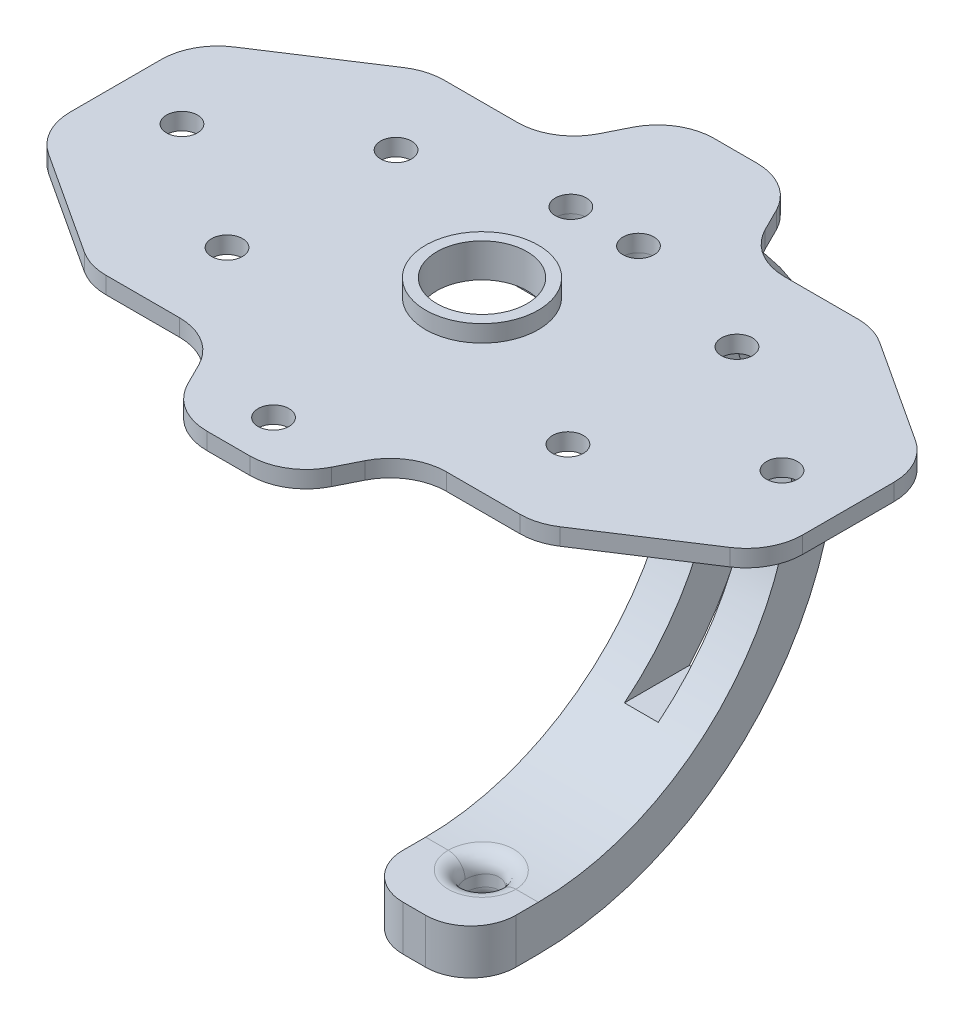
from build123d import *

# Parameters (mm, degrees)
SKETCH1_W                = 130
SKETCH1_H                = 130
BOSS_EXTRUDE1_DEPTH      = 3
SKETCH2_R                = 8
CUT_EXTRUDE1_DEPTH       = 3
M5_CLEARANCE_HOLE1_D     = 5.5
SKETCH5_OUTSIDE_W        = 168.774
SKETCH5_OUTSIDE_H        = 168.774
CUT_EXTRUDE2_DEPTH       = 92.972822073
BOSS_EXTRUDE2_DEPTH      = 3
FILLET1_R                = 10
M5_CLEARANCE_HOLE2_D     = 5.5
BOSS_EXTRUDE3_START      = 3
SKETCH9_R                = 10
SKETCH9_R_2              = 8
BOSS_EXTRUDE3_DEPTH      = 3
BOSS_EXTRUDE4_DEPTH      = 10
FILLET3_R                = 8
SKETCH12_W               = 6
SKETCH12_H               = 60
CUT_EXTRUDE4_DEPTH       = 126.231785103
CUT_EXTRUDE5_DEPTH       = 124.753787821
CUT_EXTRUDE5_DEPTH_BACK  = 124.753787821
SKETCH13_R               = 3
FILLET4_R                = 3
M5_CLEARANCE_HOLE3_D     = 5.5
M5_CLEARANCE_HOLE3_DEPTH = 10
M5_CLEARANCE_HOLE3_TIP   = 1.652366702


# Read off the part's stored shape, not the designer's step: Split1
with BuildPart() as part:
    # Sketch1 → Boss-Extrude1 (new body)
    with BuildSketch(Plane(origin=(0, 0, 0), x_dir=(1, 0, 0), z_dir=(0, 1, 0))):
        Rectangle(SKETCH1_W, SKETCH1_H)
    extrude(amount=BOSS_EXTRUDE1_DEPTH)

    # Sketch2 → Cut-Extrude1 (cut)
    with BuildSketch(Plane(origin=(0, 3, 0), x_dir=(1, 0, 0), z_dir=(0, 1, 0))):
        with Locations(Location((0, 0, 0), (0, 0, 270))):
            Circle(SKETCH2_R)
    extrude(amount=-CUT_EXTRUDE1_DEPTH, mode=Mode.SUBTRACT)

    # M5 Clearance Hole1 (through all)
    with Locations(Plane(origin=(0, 0, 0), x_dir=(-1, 0, 0), z_dir=(0, -1, 0))):
        with Locations((30.25, 15), (53.25, 0), (30.25, -15), (-30.25, -15), (-53.25, 0), (-30.25, 15)):
            Hole(M5_CLEARANCE_HOLE1_D / 2)

    # Sketch5 outside → Cut-Extrude2 (cut, through all)
    with BuildSketch(Plane.XZ):
        Rectangle(SKETCH5_OUTSIDE_W, SKETCH5_OUTSIDE_H)
        Polygon((-65, 13.5), (-39.7, 30), (39.7, 30), (65, 13.5), (65, -13.5), (39.7, -30), (-39.7, -30), (-65, -13.5), align=None, mode=Mode.SUBTRACT)
    extrude(amount=-CUT_EXTRUDE2_DEPTH, mode=Mode.SUBTRACT)

    # Sketch6 → Boss-Extrude2 (add)
    with BuildSketch(Plane(origin=(0, 3, 0), x_dir=(1, 0, 0), z_dir=(0, 1, 0))):
        Polygon((-17.5, 30), (-10, 45), (10, 45), (17.5, 30), align=None)
        Polygon((-17.5, -30), (17.5, -30), (10, -45), (-10, -45), align=None)
    extrude(amount=-BOSS_EXTRUDE2_DEPTH)

    # Fillet1
    fillet1_edges = [part.edges().sort_by_distance(p)[0] for p in [
        (-17.5, 1.5, -30),
        (-10, 1.5, -45),
        (10, 1.5, -45),
        (-10, 1.5, 45),
        (-17.5, 1.5, 30),
        (17.5, 1.5, 30),
        (10, 1.5, 45),
        (-65, 1.5, 13.5),
        (-39.7, 1.5, 30),
        (39.7, 1.5, 30),
        (65, 1.5, 13.5),
        (65, 1.5, -13.5),
        (39.7, 1.5, -30),
        (-39.7, 1.5, -30),
        (-65, 1.5, -13.5),
        (17.5, 1.5, -30),
    ]]
    fillet(fillet1_edges, radius=FILLET1_R)

    # M5 Clearance Hole2 (through all)
    with Locations(Plane(origin=(0, 3, 0), x_dir=(1, 0, 0), z_dir=(0, 1, 0))):
        with Locations((0, -37)):
            Hole(M5_CLEARANCE_HOLE2_D / 2)

    # Sketch9 → Boss-Extrude3 (add)
    with BuildSketch(Plane(origin=(0, 3, 0), x_dir=(1, 0, 0), z_dir=(0, 1, 0)).offset(BOSS_EXTRUDE3_START)):
        with Locations(Location((0, 0, 0), (0, 0, 270))):
            Circle(SKETCH9_R)
        with Locations(Location((0, 0, 0), (0, 0, 270))):
            Circle(SKETCH9_R_2, mode=Mode.SUBTRACT)
    extrude(amount=-BOSS_EXTRUDE3_DEPTH)

    # Sketch11 → Boss-Extrude4 (add, symmetric)
    with BuildSketch(Plane(origin=(0, 0, 0), x_dir=(0, 0, -1), z_dir=(1, 0, 0))):
        with BuildLine():
            Line((14.770677301, 0), (34.770677301, 0))
            ThreePointArc((34.770677301, 0), (49.643730722, -58.560711193), (0, -93))
            Line((0, -93), (-12, -93))
            Line((-12, -93), (-12, -85))
            Line((-12, -85), (0, -85))
            ThreePointArc((0, -85), (41.892720131, -56.431676725), (30.594117082, -7))
            Line((30.594117082, -7), (14.770677301, -7))
            Line((14.770677301, -7), (14.770677301, 0))
        make_face()
    extrude(amount=BOSS_EXTRUDE4_DEPTH, both=True)

    # Fillet3
    fillet3_edges = [part.edges().sort_by_distance(p)[0] for p in [
        (-10, -89, 12),
        (10, -89, 12),
    ]]
    fillet(fillet3_edges, radius=FILLET3_R)

    # Sketch12 → Cut-Extrude4 (cut, through all)
    with BuildSketch(Plane.XY):
        with Locations((0, -45)):
            Rectangle(SKETCH12_W, SKETCH12_H)
    extrude(amount=-CUT_EXTRUDE4_DEPTH, mode=Mode.SUBTRACT)

    # Sketch13 → Cut-Extrude5 (cut, two sides: drawn at the far end of the back side and taken through both)
    with BuildSketch(Plane(origin=(0, -85, 0), x_dir=(1, 0, 0), z_dir=(0, 1, 0)).offset(-CUT_EXTRUDE5_DEPTH_BACK)):
        with Locations(Location((0, 0, 0), (0, 0, 180))):
            Circle(SKETCH13_R)
    extrude(amount=CUT_EXTRUDE5_DEPTH + CUT_EXTRUDE5_DEPTH_BACK, mode=Mode.SUBTRACT)

    # Fillet4
    fillet4_edges = [part.edges().sort_by_distance(p)[0] for p in [
        (0, -92.915026222, -2.999999998),
        (0, -93, 3),
        (0, -85, 3),
        (0, -84.899888642, -2.999999998),
    ]]
    fillet(fillet4_edges, radius=FILLET4_R)

    # M5 Clearance Hole3
    with Locations(Plane(origin=(0, 3, 0), x_dir=(1, 0, 0), z_dir=(0, 1, 0))):
        with Locations((-6, 21.770677301), (6, 21.770677301)):
            Hole(M5_CLEARANCE_HOLE3_D / 2, depth=M5_CLEARANCE_HOLE3_DEPTH)
            with Locations((0, 0, -(M5_CLEARANCE_HOLE3_DEPTH + M5_CLEARANCE_HOLE3_TIP / 2))):  # 118° drill point
                Cone(0, M5_CLEARANCE_HOLE3_D / 2, M5_CLEARANCE_HOLE3_TIP, mode=Mode.SUBTRACT)


with BuildPart() as body_2:
    # Split1: the piece on the far side of the plane
    add(part.part)
    split(bisect_by=Plane(origin=(0, 0, 0), x_dir=(1, 0, 0), z_dir=(0, 1, 0)), keep=Keep.BOTTOM)


with BuildPart() as part_1:
    add(part.part)

    # Split1
    split(bisect_by=Plane(origin=(0, 0, 0), x_dir=(1, 0, 0), z_dir=(0, 1, 0)), keep=Keep.TOP)


solid = Compound([body_2.part, part_1.part])
